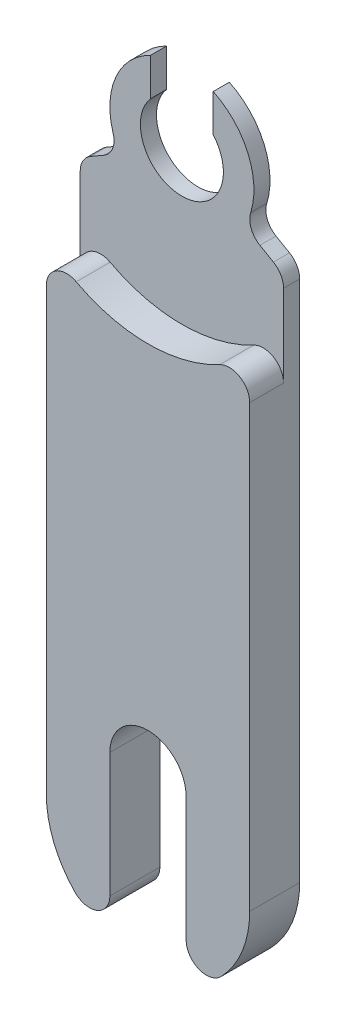
from build123d import *

# Parameters (mm, degrees)
SKETCH3_R           = 2.45
BOSS_EXTRUDE1_DEPTH = 0.95
SKETCH4_W           = 3.7
SKETCH4_H           = 6
CUT_EXTRUDE1_DEPTH  = 1
BOSS_EXTRUDE2_DEPTH = 2
CUT_EXTRUDE2_DEPTH  = 42.54157556
CUT_EXTRUDE3_DEPTH  = 42.05225841
FILLET1_R           = 1.2


with BuildPart() as part:
    # Sketch3 → Boss-Extrude1 (new body)
    with BuildSketch(Plane.XY):
        with BuildLine():
            Line((6, 0), (6, -35))
            ThreePointArc((6, -35), (0, -41), (-6, -35))
            Line((-6, -35), (-6, 0))
            ThreePointArc((-6, 0), (0, 6), (6, 0))
        make_face()
        Circle(SKETCH3_R, mode=Mode.SUBTRACT)
    extrude(amount=BOSS_EXTRUDE1_DEPTH)

    # Sketch4 → Cut-Extrude1 (cut)
    with BuildSketch(Plane.XY.offset(0.95)):
        with Locations((0, 3)):
            Rectangle(SKETCH4_W, SKETCH4_H)
    extrude(amount=-CUT_EXTRUDE1_DEPTH, mode=Mode.SUBTRACT)

    # Sketch5 → Boss-Extrude2 (add)
    with BuildSketch(Plane.XY.offset(0.95)):
        with BuildLine():
            Line((-6, -6.708203932), (-6, -35))
            ThreePointArc((-6, -35), (0, -41), (6, -35))
            Line((6, -35), (6, -6.708203932))
            ThreePointArc((6, -6.708203932), (0, -9), (-6, -6.708203932))
        make_face()
    extrude(amount=BOSS_EXTRUDE2_DEPTH)

    # Sketch6 → Cut-Extrude2 (cut, through all)
    with BuildSketch(Plane.XY.offset(2.95)):
        with BuildLine():
            Line((2.25, -31), (2.25, -41))
            ThreePointArc((2.25, -41), (0, -43.25), (-2.25, -41))
            Line((-2.25, -41), (-2.25, -31))
            ThreePointArc((-2.25, -31), (0, -28.75), (2.25, -31))
        make_face()
    extrude(amount=-CUT_EXTRUDE2_DEPTH, mode=Mode.SUBTRACT)

    # Sketch7 → Cut-Extrude3 (cut, through all)
    with BuildSketch(Plane.XY.offset(0.95)):
        with BuildLine():
            Line((-6, 0), (-6, -3.464101615))
            Line((-6, -3.464101615), (-3.680607966, -2.125))
            ThreePointArc((-3.680607966, -2.125), (-4.062164047, 1.249529214), (-1.85, 3.826225294))
            Line((-1.85, 3.826225294), (-1.85, 5.707670278))
            ThreePointArc((-1.85, 5.707670278), (-4.852834223, 3.528455753), (-6, 0))
        make_face()
        with BuildLine():
            ThreePointArc((1.85, 3.826225294), (4.062164047, 1.249529214), (3.680607966, -2.125))
            Line((3.680607966, -2.125), (6, -3.464101615))
            Line((6, -3.464101615), (6, 0))
            ThreePointArc((6, 0), (4.852834223, 3.528455753), (1.85, 5.707670278))
            Line((1.85, 5.707670278), (1.85, 3.826225294))
        make_face()
    extrude(amount=-CUT_EXTRUDE3_DEPTH, mode=Mode.SUBTRACT)

    # Fillet1
    fillet1_edges = [part.edges().sort_by_distance(p)[0] for p in [
        (2.25, -40.562148865, 1.475),
        (-2.25, -40.562148865, 1.475),
        (-6, -6.708203932, 1.95),
        (6, -6.708203932, 1.95),
        (-3.680607966, -2.125, 0.475),
        (3.680607966, -2.125, 0.475),
        (6, -3.464101615, 0.475),
        (-6, -3.464101615, 0.475),
    ]]
    fillet(fillet1_edges, radius=FILLET1_R)


solid = part.part
